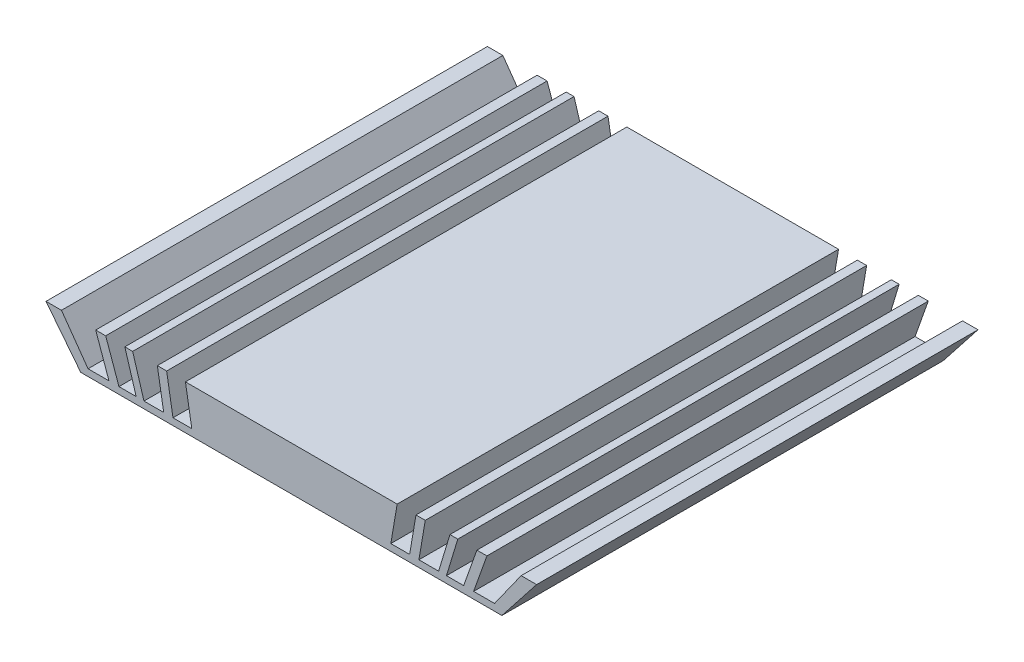
from build123d import *

# Parameters (mm, degrees)
CUT_EXTRUDE1_START = -61
CUT_EXTRUDE1_DEPTH = 61


# Read off the part's stored shape, not the designer's step: Cut-Extrude1
with BuildPart() as part:
    # Sketch1 → Loft1 section 0
    with BuildSketch(Plane(origin=(0, 0, 0), x_dir=(1, 0, 0), z_dir=(0, 1, 0))):
        with BuildLine():
            Line((0, 0), (58.2, 0))
            Line((58.2, 0), (58.2, 61))
            Line((58.2, 61), (0, 61))
            Line((0, 61), (0, 0))
        make_face()
    # Sketch2 → Loft1 section 1
    with BuildSketch(Plane(origin=(0, 6.099999992, 0), x_dir=(1, 0, 0), z_dir=(0, 1, 0))):
        with BuildLine():
            Line((-4.8, 61), (63, 61))
            Line((63, 61), (63, 0))
            Line((63, 0), (-4.8, 0))
            Line((-4.8, 0), (-4.8, 61))
        make_face()
    loft()

    # Cut-Extrude1 outline → Cut-Extrude1 (cut)
    with BuildSketch(Plane.XY.offset(CUT_EXTRUDE1_START)):
        Polygon((60.861632844, 6.099999992), (56.132109475, 6.099999992), (54.298183465, 0.936182189), (57.189353849, 0.936182189), align=None)
        Polygon((54.750384399, 6.099999992), (52.107282262, 6.099999992), (50.541618156, 0.936182189), (52.916458389, 0.936182189), align=None)
        Polygon((51.025910518, 6.099999992), (47.612762768, 6.099999992), (46.735990868, 0.936182189), (49.460246412, 0.936182189), align=None)
        Polygon((46.328918201, 6.099999992), (43.729915785, 6.099999992), (42.853143886, 0.936182189), (45.452146301, 0.936182189), align=None)
        Polygon((14.470084215, 6.099999992), (11.871081799, 6.099999992), (12.747853699, 0.936182189), (15.346856114, 0.936182189), align=None)
        Polygon((10.587237232, 6.099999992), (7.174089482, 6.099999992), (8.739753588, 0.936182189), (11.464009132, 0.936182189), align=None)
        Polygon((6.092717738, 6.099999992), (3.449615601, 6.099999992), (5.283541611, 0.936182189), (7.658381844, 0.936182189), align=None)
        Polygon((1.010646151, 0.936182189), (3.901816535, 0.936182189), (2.067890525, 6.099999992), (-2.661632844, 6.099999992), align=None)
    extrude(amount=CUT_EXTRUDE1_DEPTH, mode=Mode.SUBTRACT)


solid = part.part
